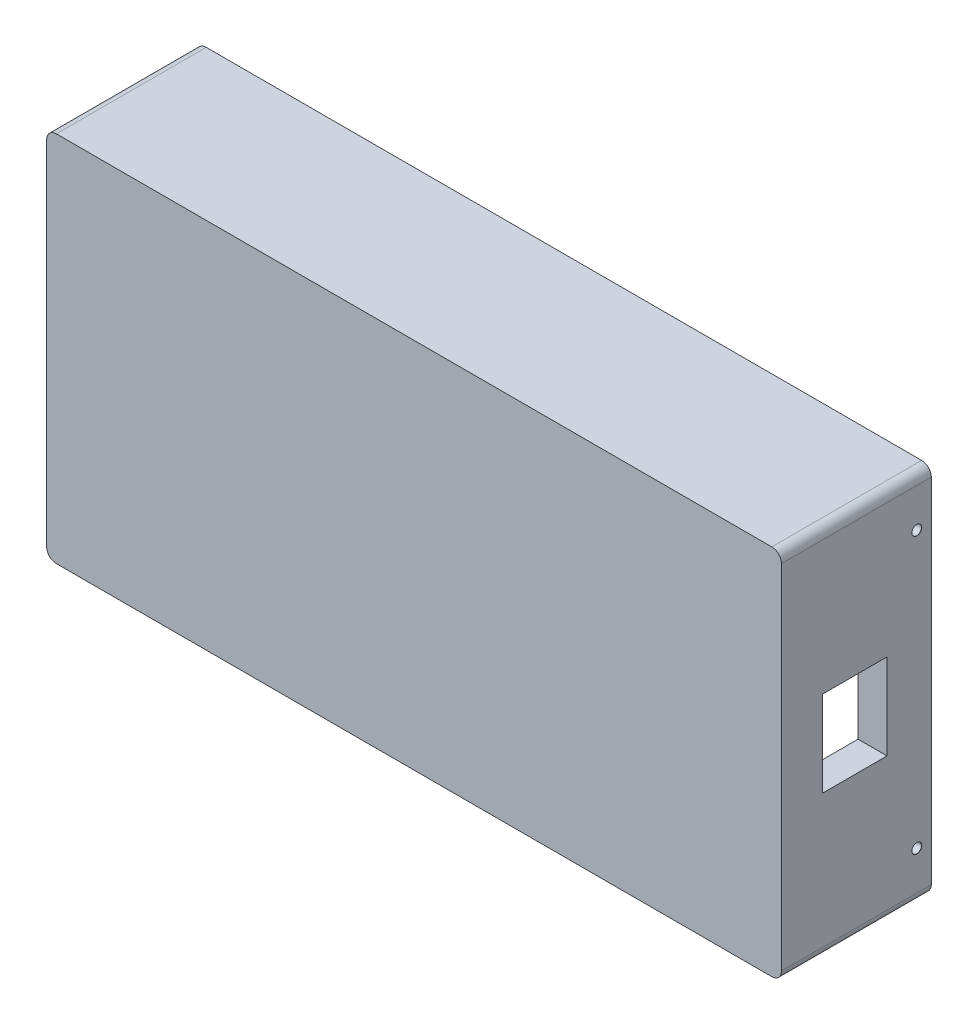
from build123d import *

# Parameters (mm, degrees)
IZIM1_W                     = 140
IZIM1_H                     = 65
Y_KSEKLIK_EKSTR_ZYON1_DEPTH = 25
BO_ALTMA3_T                 = 6
IZIM2_R                     = 2.25
KES_EKSTR_ZYON1_DEPTH       = 25
IZIM3_W                     = 13.33242511
IZIM3_H                     = 17.74072696
KES_EKSTR_ZYON2_DEPTH       = 25
RADYUS1_R                   = 2
Y_KSEKLIK_EKSTR_ZYON2_START = 25
IZIM4_R                     = 2.25
Y_KSEKLIK_EKSTR_ZYON2_DEPTH = 25
IZIM5_R                     = 1
KES_EKSTR_ZYON3_DEPTH       = 20
KES_EKSTR_ZYON4_START       = -20
IZIM6_R                     = 1
KES_EKSTR_ZYON4_DEPTH       = 20


# Read off the part's stored shape, not the designer's step: M2 Dişli Delik1
with BuildPart() as part:
    # Çizim1 → Yükseklik-Ekstrüzyon1 (new body)
    with BuildSketch(Plane.XY):
        Rectangle(IZIM1_W, IZIM1_H)
    extrude(amount=Y_KSEKLIK_EKSTR_ZYON1_DEPTH)

    # İç Boşaltma3
    bo_altma3_openings = [part.faces().sort_by_distance(p)[0] for p in [
        (0, 0, 0),
    ]]
    offset(amount=BO_ALTMA3_T, openings=bo_altma3_openings, kind=Kind.INTERSECTION)

    # Çizim2 → Kes-Ekstrüzyon1 (cut)
    with BuildSketch(Plane(origin=(0, 0, 0), x_dir=(-1, 0, 0), z_dir=(0, 0, -1))):
        with Locations((-73, -35.5)):
            Circle(IZIM2_R)
        with Locations(Location((73, -35.5, 0), (0, 0, 180))):
            Circle(IZIM2_R)
        with Locations(Location((-73, 35.5, 0), (0, 0, 180))):
            Circle(IZIM2_R)
        with Locations((73, 35.5)):
            Circle(IZIM2_R)
    extrude(amount=-KES_EKSTR_ZYON1_DEPTH, mode=Mode.SUBTRACT)

    # Çizim3 → Kes-Ekstrüzyon2 (cut)
    with BuildSketch(Plane.ZY.offset(-70)):
        with Locations((15.822558672, 0)):
            Rectangle(IZIM3_W, IZIM3_H)
    extrude(amount=-KES_EKSTR_ZYON2_DEPTH, mode=Mode.SUBTRACT)

    # Radyus1
    radyus1_edges = [part.edges().sort_by_distance(p)[0] for p in [
        (76, -38.5, 15.5),
        (-76, -38.5, 15.5),
        (-76, 38.5, 15.5),
        (76, 38.5, 15.5),
    ]]
    fillet(radyus1_edges, radius=RADYUS1_R)

    # Çizim4 → Yükseklik-Ekstrüzyon2 (add)
    with BuildSketch(Plane(origin=(0, 0, 25), x_dir=(-1, 0, 0), z_dir=(0, 0, -1)).offset(Y_KSEKLIK_EKSTR_ZYON2_START)):
        with Locations((73, 35.5)):
            Circle(IZIM4_R)
        with Locations((73, -35.5)):
            Circle(IZIM4_R)
        with Locations((-73, 35.5)):
            Circle(IZIM4_R)
        with Locations((-73, -35.5)):
            Circle(IZIM4_R)
    extrude(amount=-Y_KSEKLIK_EKSTR_ZYON2_DEPTH)

    # Çizim5 → Kes-Ekstrüzyon3 (cut)
    with BuildSketch(Plane(origin=(76, 0, 0), x_dir=(0, 0, -1), z_dir=(1, 0, 0))):
        with Locations((-3, 28.5)):
            Circle(IZIM5_R)
        with Locations(Location((-3, -28.5, 0), (0, 0, 180))):
            Circle(IZIM5_R)
    extrude(amount=-KES_EKSTR_ZYON3_DEPTH, mode=Mode.SUBTRACT)

    # Çizim6 → Kes-Ekstrüzyon4 (cut)
    with BuildSketch(Plane.ZY.offset(76).offset(KES_EKSTR_ZYON4_START)):
        with Locations(Location((3, 28.5, 0), (0, 0, 180))):
            Circle(IZIM6_R)
        with Locations((3, -28.5)):
            Circle(IZIM6_R)
    extrude(amount=KES_EKSTR_ZYON4_DEPTH, mode=Mode.SUBTRACT)

    # M2 Dişli Delik1 outline → M2 Dişli Delik1 (revolve, cut)
    with BuildSketch(Plane(origin=(0, 28.5, 3), x_dir=(0, 1, 0), z_dir=(0, 0, -1))):
        Polygon((1, 76), (1, 75.97124079), (1.025, 76), align=None)
        Polygon((1.025, -76), (1, -75.97124079), (1, -76), align=None)
    revolve(axis=Axis((0, 28.5, 3), (1, 0, 0)), mode=Mode.SUBTRACT)

    # M2 Di_li Delik1 2 outline → M2 Di_li Delik1 2 (revolve, cut)
    with BuildSketch(Plane(origin=(0, -28.5, 3), x_dir=(0, 1, 0), z_dir=(0, 0, -1))):
        Polygon((1, 76), (1, 75.97124079), (1.025, 76), align=None)
        Polygon((1.025, -76), (1, -75.97124079), (1, -76), align=None)
    revolve(axis=Axis((0, -28.5, 3), (1, 0, 0)), mode=Mode.SUBTRACT)


solid = part.part
